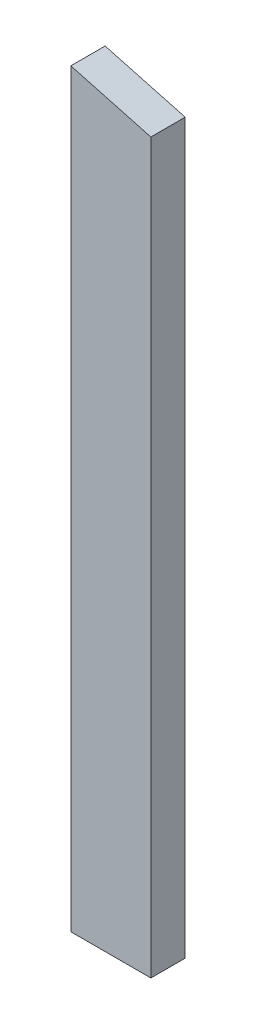
from build123d import *

# Parameters (mm, degrees)
BOSS_EXTRUDE1_DEPTH = 38.1


with BuildPart() as part:
    # Sketch1 → Boss-Extrude1 (new body)
    with BuildSketch(Plane.XY):
        Polygon((-336.94756949, 17.989834332), (-248.04756949, 17.989834332), (-248.04756949, 826.502410303), (-336.94756949, 850.475444011), align=None)
    extrude(amount=BOSS_EXTRUDE1_DEPTH)


solid = part.part
